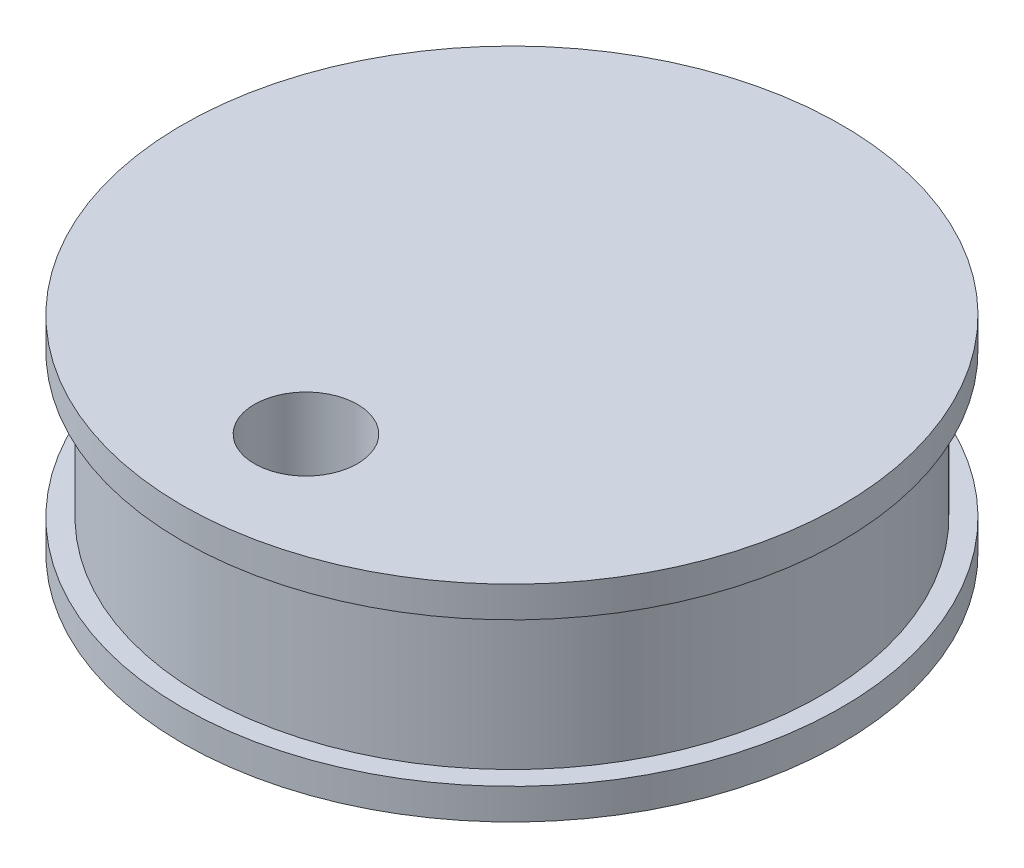
from build123d import *

# Parameters (mm, degrees)
SKETCH4_R          = 3.175
CUT_EXTRUDE1_DEPTH = 57.167894744


with BuildPart() as part:
    # Sketch3 → Revolve1 (revolve)
    with BuildSketch(Plane.XY):
        Polygon((30.48, -1.361443582), (50.8, -1.361443582), (50.8, 0.543556418), (49.53, 0.543556418), (49.53, 9.433556418), (50.8, 9.433556418), (50.8, 11.338556418), (30.48, 11.338556418), align=None)
    revolve(axis=Axis((30.48, 11.338556418, 0), (0, -1, 0)))

    # Sketch4 → Cut-Extrude1 (cut, through all)
    with BuildSketch(Plane(origin=(0, 11.338556418, 0), x_dir=(1, 0, 0), z_dir=(0, 1, 0))):
        with Locations((30.48, -12.7)):
            Circle(SKETCH4_R)
    extrude(amount=-CUT_EXTRUDE1_DEPTH, mode=Mode.SUBTRACT)


solid = part.part
